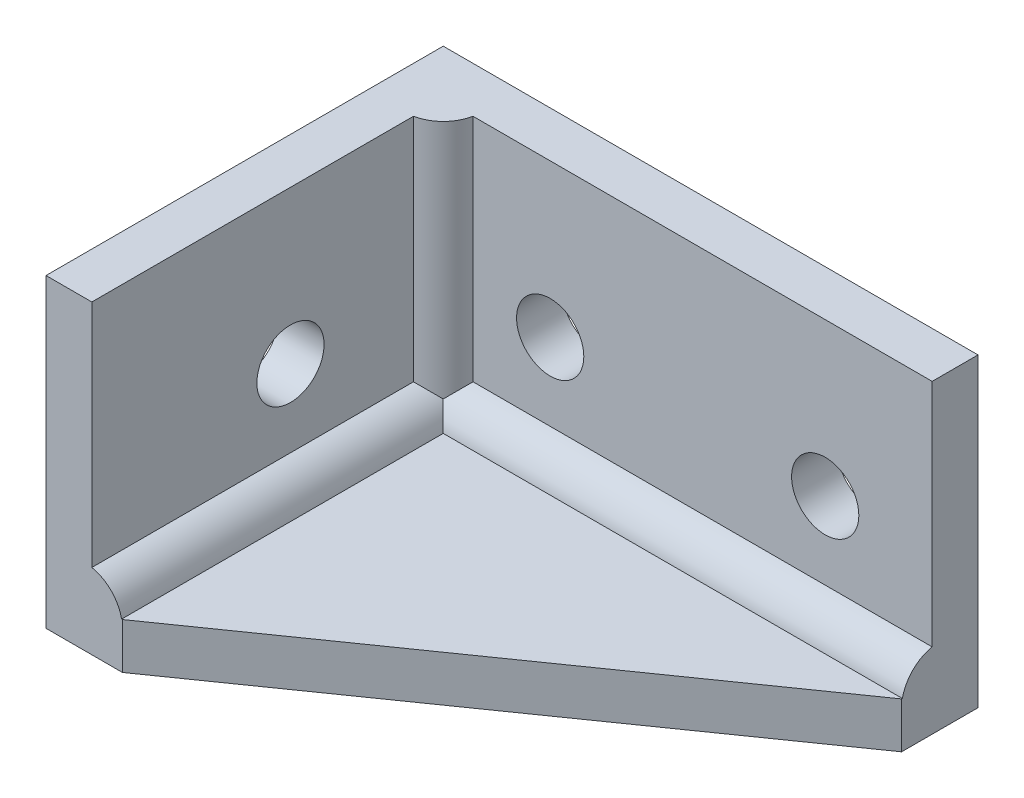
from build123d import *

# Parameters (mm, degrees)
BOSS_EXTRUDE1_DEPTH = 20
CUT_EXTRUDE1_DEPTH  = 17
BOSS_EXTRUDE2_REACH = 49.969
SKETCH3_R           = 2.5
BOSS_EXTRUDE3_REACH = 49.969
SKETCH4_R           = 2.5
BOSS_EXTRUDE4_REACH = 49.969
SKETCH5_R           = 2.5
SKETCH6_R           = 2.2
CUT_EXTRUDE2_DEPTH  = 47.411205543
SKETCH7_R           = 2.2
CUT_EXTRUDE3_DEPTH  = 46.82575695


with BuildPart() as part:
    # Sketch1 → Boss-Extrude1 (new body)
    with BuildSketch(Plane(origin=(0, 0, 0), x_dir=(1, 0, 0), z_dir=(0, 1, 0))):
        Polygon((0, 0), (35, 0), (35, -5), (5, -26), (0, -26), align=None)
    extrude(amount=BOSS_EXTRUDE1_DEPTH)

    # Sketch2 → Cut-Extrude1 (cut)
    with BuildSketch(Plane(origin=(0, 20, 0), x_dir=(1, 0, 0), z_dir=(0, 1, 0))):
        Polygon((35, -3), (3, -3), (3, -26), (5, -26), (35, -5), align=None)
    extrude(amount=-CUT_EXTRUDE1_DEPTH, mode=Mode.SUBTRACT)

    # Sketch3 → Boss-Extrude2 (add, up to next)
    with BuildSketch(Plane.XY.offset(26), mode=Mode.PRIVATE) as boss_extrude2_sk1:
        with Locations((2.5, 2.5)):
            Circle(SKETCH3_R)
    boss_extrude2_tool1 = extrude(boss_extrude2_sk1.sketch, amount=-BOSS_EXTRUDE2_REACH, mode=Mode.PRIVATE) - part.part
    add(boss_extrude2_tool1.solids().sort_by_distance((2.5, 2.5, 26))[0])

    # Sketch4 → Boss-Extrude3 (add, up to next)
    with BuildSketch(Plane(origin=(35, 0, 0), x_dir=(0, 0, -1), z_dir=(1, 0, 0)), mode=Mode.PRIVATE) as boss_extrude3_sk1:
        with Locations((-2.5, 2.5)):
            Circle(SKETCH4_R)
    boss_extrude3_tool1 = extrude(boss_extrude3_sk1.sketch, amount=-BOSS_EXTRUDE3_REACH, mode=Mode.PRIVATE) - part.part
    add(boss_extrude3_tool1.solids().sort_by_distance((35, 2.5, 2.5))[0])

    # Sketch5 → Boss-Extrude4 (add, up to next)
    with BuildSketch(Plane(origin=(0, 20, 0), x_dir=(1, 0, 0), z_dir=(0, 1, 0)), mode=Mode.PRIVATE) as boss_extrude4_sk1:
        with Locations((2.5, -2.5)):
            Circle(SKETCH5_R)
    boss_extrude4_tool1 = extrude(boss_extrude4_sk1.sketch, amount=-BOSS_EXTRUDE4_REACH, mode=Mode.PRIVATE) - part.part
    add(boss_extrude4_tool1.solids().sort_by_distance((2.5, 20, 2.5))[0])

    # Sketch6 → Cut-Extrude2 (cut, through all)
    with BuildSketch(Plane.XY.offset(3)):
        with Locations((10, 10)):
            Circle(SKETCH6_R)
        with Locations((28, 10)):
            Circle(SKETCH6_R)
    extrude(amount=-CUT_EXTRUDE2_DEPTH, mode=Mode.SUBTRACT)

    # Sketch7 → Cut-Extrude3 (cut, through all)
    with BuildSketch(Plane(origin=(3, 0, 0), x_dir=(0, 0, -1), z_dir=(1, 0, 0))):
        with Locations((-13, 10)):
            Circle(SKETCH7_R)
    extrude(amount=-CUT_EXTRUDE3_DEPTH, mode=Mode.SUBTRACT)


solid = part.part
